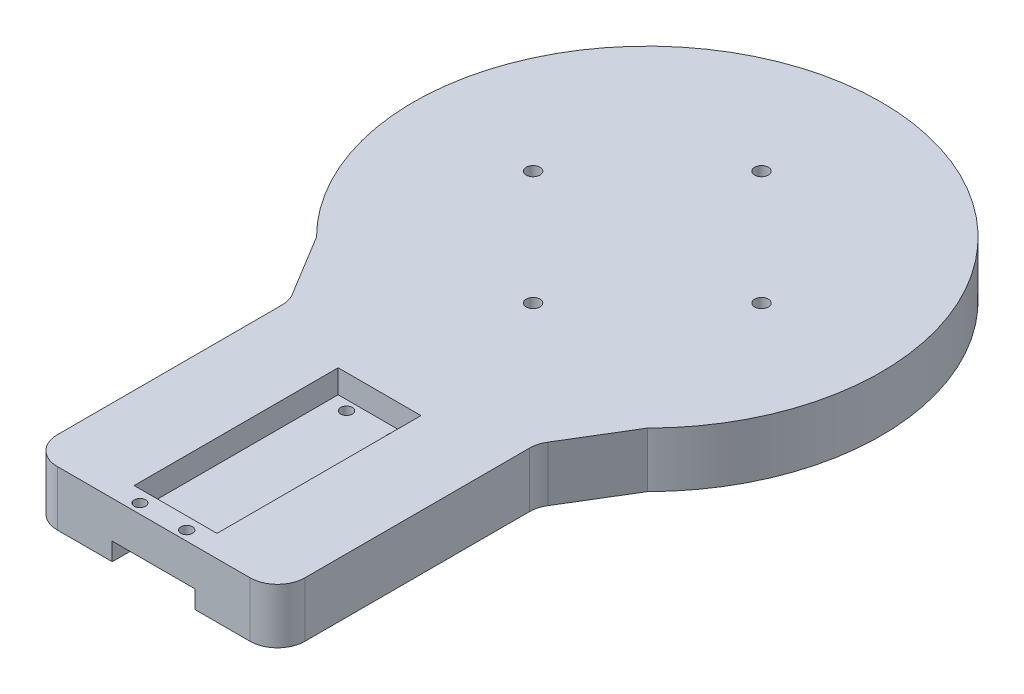
from build123d import *

# Parameters (mm, degrees)
SKETCH1_R           = 2.5
BOSS_EXTRUDE1_DEPTH = 20
SKETCH2_W           = 30.1
SKETCH2_H           = 82.1
CUT_EXTRUDE1_DEPTH  = 8.5
SKETCH3_W           = 30.1
SKETCH3_H           = 82.1
CUT_EXTRUDE2_DEPTH  = 6.5
CUT_EXTRUDE3_REACH  = 200.842
SKETCH5_R           = 2.1
BOSS_EXTRUDE2_START = 8.5
SKETCH6_W           = 30.1
SKETCH6_H           = 7.969588383
SKETCH6_R           = 2.1
SKETCH6_R_2         = 2.056615375
BOSS_EXTRUDE2_DEPTH = 8.5


with BuildPart() as part:
    # Sketch1 → Boss-Extrude1 (new body)
    with BuildSketch(Plane(origin=(0, 0, 0), x_dir=(1, 0, 0), z_dir=(0, 1, 0))):
        with BuildLine():
            Line((60.104076401, -60.104076401), (46.450402953, -82.609312867))
            ThreePointArc((46.450402953, -82.609312867), (45.36942446, -85.103300576), (45, -87.796257086))
            Line((45, -87.796257086), (45, -118.89))
            Line((45, -118.89), (45, -169.39))
            ThreePointArc((45, -169.39), (42.071067812, -176.461067812), (35, -179.39))
            Line((35, -179.39), (-35, -179.39))
            ThreePointArc((-35, -179.39), (-42.071067812, -176.461067812), (-45, -169.39))
            Line((-45, -169.39), (-45, -118.89))
            Line((-45, -118.89), (-45, -87.796257086))
            ThreePointArc((-45, -87.796257086), (-45.36942446, -85.103300576), (-46.450402953, -82.609312867))
            Line((-46.450402953, -82.609312867), (-60.104076401, -60.104076401))
            ThreePointArc((-60.104076401, -60.104076401), (0, 85), (60.104076401, -60.104076401))
        make_face()
        with Locations((0, 41.5)):
            Circle(SKETCH1_R, mode=Mode.SUBTRACT)
        with Locations((41.5, 0)):
            Circle(SKETCH1_R, mode=Mode.SUBTRACT)
        with Locations((0, -41.5)):
            Circle(SKETCH1_R, mode=Mode.SUBTRACT)
        with Locations((-41.5, 0)):
            Circle(SKETCH1_R, mode=Mode.SUBTRACT)
    extrude(amount=BOSS_EXTRUDE1_DEPTH)

    # Sketch2 → Cut-Extrude1 (cut)
    with BuildSketch(Plane(origin=(0, 20, 0), x_dir=(1, 0, 0), z_dir=(0, 1, 0))):
        with Locations((0, -138.34)):
            Rectangle(SKETCH2_W, SKETCH2_H)
    extrude(amount=-CUT_EXTRUDE1_DEPTH, mode=Mode.SUBTRACT)

    # Sketch3 → Cut-Extrude2 (cut)
    with BuildSketch(Plane.XZ):
        with Locations((0, 138.34)):
            Rectangle(SKETCH3_W, SKETCH3_H)
    extrude(amount=-CUT_EXTRUDE2_DEPTH, mode=Mode.SUBTRACT)

    # Sketch5 → Cut-Extrude3 (cut, up to next)
    with BuildSketch(Plane(origin=(0, 11.5, 0), x_dir=(1, 0, 0), z_dir=(0, 1, 0)), mode=Mode.PRIVATE) as cut_extrude3_sk1:
        with Locations((-8.5, -100.8)):
            Circle(SKETCH5_R)
    cut_extrude3_tool1 = extrude(cut_extrude3_sk1.sketch, amount=-CUT_EXTRUDE3_REACH, mode=Mode.PRIVATE) & part.part
    # Sketch5 → Cut-Extrude3 (cut, up to next)
    with BuildSketch(Plane(origin=(0, 11.5, 0), x_dir=(1, 0, 0), z_dir=(0, 1, 0)), mode=Mode.PRIVATE) as cut_extrude3_sk2:
        with Locations((8.5, -100.8)):
            Circle(SKETCH5_R)
    cut_extrude3_tool2 = extrude(cut_extrude3_sk2.sketch, amount=-CUT_EXTRUDE3_REACH, mode=Mode.PRIVATE) & part.part
    # Sketch5 → Cut-Extrude3 (cut, up to next)
    with BuildSketch(Plane(origin=(0, 11.5, 0), x_dir=(1, 0, 0), z_dir=(0, 1, 0)), mode=Mode.PRIVATE) as cut_extrude3_sk3:
        with Locations((8.5, -175.88)):
            Circle(SKETCH5_R)
    cut_extrude3_tool3 = extrude(cut_extrude3_sk3.sketch, amount=-CUT_EXTRUDE3_REACH, mode=Mode.PRIVATE) & part.part
    # Sketch5 → Cut-Extrude3 (cut, up to next)
    with BuildSketch(Plane(origin=(0, 11.5, 0), x_dir=(1, 0, 0), z_dir=(0, 1, 0)), mode=Mode.PRIVATE) as cut_extrude3_sk4:
        with Locations((-8.5, -175.88)):
            Circle(SKETCH5_R)
    cut_extrude3_tool4 = extrude(cut_extrude3_sk4.sketch, amount=-CUT_EXTRUDE3_REACH, mode=Mode.PRIVATE) & part.part
    add(cut_extrude3_tool1.solids().sort_by_distance((-8.5, 11.5, 100.8))[0], mode=Mode.SUBTRACT)
    add(cut_extrude3_tool2.solids().sort_by_distance((8.5, 11.5, 100.8))[0], mode=Mode.SUBTRACT)
    add(cut_extrude3_tool3.solids().sort_by_distance((8.5, 11.5, 175.88))[0], mode=Mode.SUBTRACT)
    add(cut_extrude3_tool4.solids().sort_by_distance((-8.5, 11.5, 175.88))[0], mode=Mode.SUBTRACT)

    # Sketch6 → Boss-Extrude2 (add)
    with BuildSketch(Plane(origin=(0, 11.5, 0), x_dir=(1, 0, 0), z_dir=(0, 1, 0)).offset(BOSS_EXTRUDE2_START)):
        with Locations((0, -175.405205808)):
            Rectangle(SKETCH6_W, SKETCH6_H)
        with Locations((8.5, -175.88)):
            Circle(SKETCH6_R, mode=Mode.SUBTRACT)
        with Locations((-8.5, -175.88)):
            Circle(SKETCH6_R_2, mode=Mode.SUBTRACT)
    extrude(amount=-BOSS_EXTRUDE2_DEPTH)


solid = part.part
